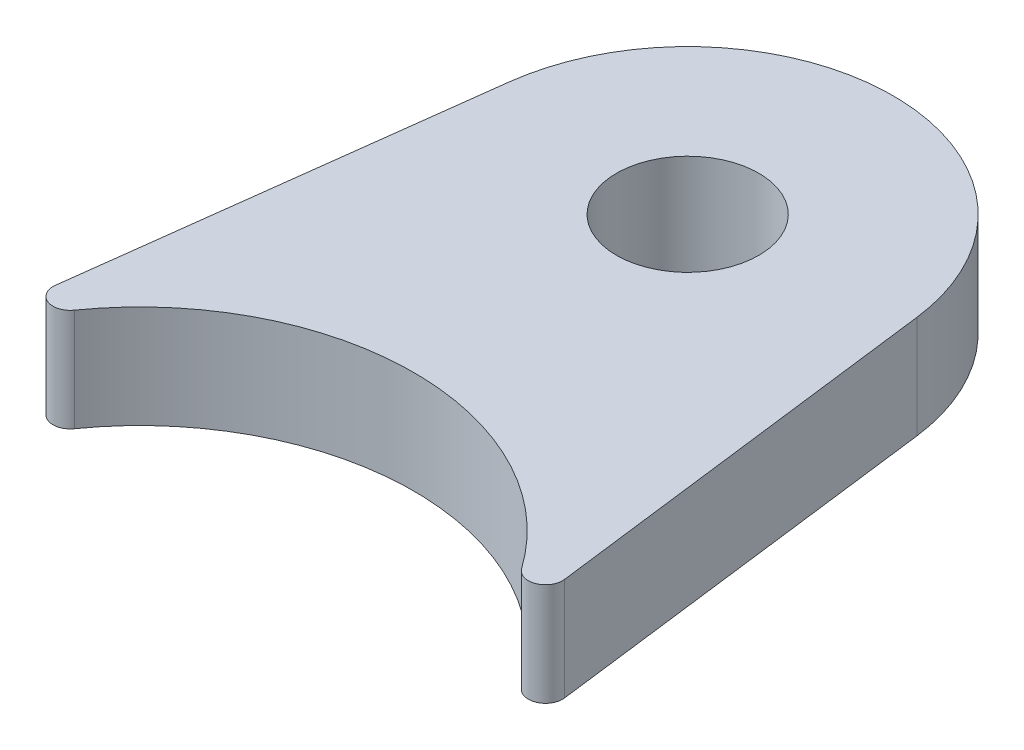
from build123d import *

# Parameters (mm, degrees)
BOSS_EXTRUDE1_DEPTH  = 4.7625
FILLET1_R            = 0.79375
M6_CLEARANCE_HOLE1_D = 6.6


with BuildPart() as part:
    # Sketch1 → Boss-Extrude1 (new body)
    with BuildSketch(Plane(origin=(0, 0, 0), x_dir=(1, 0, 0), z_dir=(0, 1, 0))):
        with BuildLine():
            Line((-9.450292964208833, 26.590625), (-12.60039061894511, 1.5874999999999988))
            ThreePointArc((-12.60039061894511, 1.5875000000000075), (6.42e-15, 12.699999999999998), (12.600390618945111, 1.587499999999999))
            Line((12.60039061894511, 1.5874999999999988), (9.450292964208833, 26.590625))
            ThreePointArc((9.450292964208835, 26.590625), (5.8e-16, 34.925), (-9.450292964208835, 26.590625))
        make_face()
    extrude(amount=BOSS_EXTRUDE1_DEPTH)

    # Fillet1
    fillet1_edges = [part.edges().sort_by_distance(p)[0] for p in [
        (12.60039061894511, 2.38125, -1.5874999999999981),
        (-12.60039061894511, 2.38125, -1.587500000000003),
    ]]
    fillet(fillet1_edges, radius=FILLET1_R)

    # M6 Clearance Hole1 (through all)
    with Locations(Plane(origin=(0, 4.7625, 0), x_dir=(1, 0, 0), z_dir=(0, 1, 0))):
        with Locations((0, 25.4)):
            Hole(M6_CLEARANCE_HOLE1_D / 2)


solid = part.part
